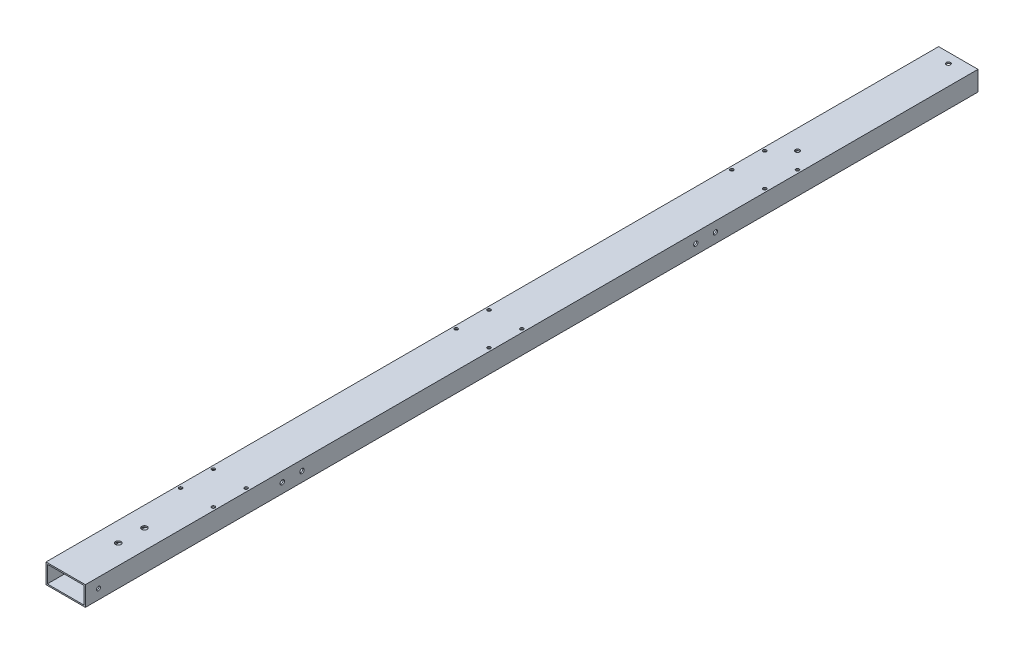
from build123d import *

# Parameters (mm, degrees)
SKETCH_1_W           = 30
SKETCH_1_H           = 15
SKETCH_1_W_2         = 28
SKETCH_1_H_2         = 13
EXTRUDE_1_DEPTH      = 800
SKETCH_4_R           = 1.5
CUT_EXTRUDE_3_DEPTH  = 801.702816281
SKETCH_5_R           = 1.65
CUT_EXTRUDE_4_DEPTH  = 801.702816281
SKETCH_6_W           = 30
SKETCH_6_H           = 15
CUT_EXTRUDE_5_DEPTH  = 300
SKETCH_8_W           = 30
SKETCH_8_H           = 15
SKETCH_8_W_2         = 28
SKETCH_8_H_2         = 13
EXTRUDE_1_2_DEPTH    = 180
SKETCH_9_R           = 2.05
CUT_EXTRUDE_7_DEPTH  = 10
CUT_EXTRUDE_8_DEPTH  = 10
SKETCH_11_R          = 1.6
CUT_EXTRUDE_9_DEPTH  = 801.702816281
CUT_EXTRUDE_10_REACH = 802.703
SKETCH_13_R          = 1.25
CUT_EXTRUDE_11_DEPTH = 801.702816281


with BuildPart() as part:
    # 草图1 → Extrude 1 (new body)
    with BuildSketch(Plane.XY):
        with Locations((15, -7.5)):
            Rectangle(SKETCH_1_W, SKETCH_1_H)
        with Locations((15, -7.5)):
            Rectangle(SKETCH_1_W_2, SKETCH_1_H_2, mode=Mode.SUBTRACT)
    extrude(amount=EXTRUDE_1_DEPTH)

    # 草图4 → 切除-拉伸3 (cut, through all)
    with BuildSketch(Plane(origin=(30, 0, 0), x_dir=(0, 0, -1), z_dir=(1, 0, 0))):
        with Locations((-790, -7.5)):
            Circle(SKETCH_4_R)
    extrude(amount=-CUT_EXTRUDE_3_DEPTH, mode=Mode.SUBTRACT)

    # 草图5 → 切除-拉伸4 (cut, through all)
    with BuildSketch(Plane(origin=(30, 0, 0), x_dir=(0, 0, -1), z_dir=(1, 0, 0))):
        with Locations((-320, -7.5)):
            Circle(SKETCH_5_R)
        with Locations((-335, -7.5)):
            Circle(SKETCH_5_R)
        with Locations((-635, -7.5)):
            Circle(SKETCH_5_R)
        with Locations((-650, -7.5)):
            Circle(SKETCH_5_R)
    extrude(amount=-CUT_EXTRUDE_4_DEPTH, mode=Mode.SUBTRACT)

    # 草图6 → 切除-拉伸5 (cut)
    with BuildSketch(Plane(origin=(0, 0, 0), x_dir=(-1, 0, 0), z_dir=(0, 0, -1))):
        with Locations((-15, -7.5)):
            Rectangle(SKETCH_6_W, SKETCH_6_H)
    extrude(amount=-CUT_EXTRUDE_5_DEPTH, mode=Mode.SUBTRACT)

    # 草图8 → Extrude 1 2 (add)
    with BuildSketch(Plane(origin=(0, 0, 300), x_dir=(-1, 0, 0), z_dir=(0, 0, -1))):
        with Locations((-15, -7.5)):
            Rectangle(SKETCH_8_W, SKETCH_8_H)
        with Locations((-15, -7.5)):
            Rectangle(SKETCH_8_W_2, SKETCH_8_H_2, mode=Mode.SUBTRACT)
    extrude(amount=EXTRUDE_1_2_DEPTH)

    # 草图9 → 切除-拉伸7 (cut)
    with BuildSketch(Plane(origin=(0, 0, 0), x_dir=(1, 0, 0), z_dir=(0, 1, 0))):
        with Locations((15, -740)):
            Circle(SKETCH_9_R)
        with Locations((15, -760)):
            Circle(SKETCH_9_R)
    extrude(amount=-CUT_EXTRUDE_7_DEPTH, mode=Mode.SUBTRACT)

    # 草图10 → 切除-拉伸8 (cut)
    with BuildSketch(Plane.XZ.offset(15)):
        with BuildLine():
            Line((8, 735), (8, 760))
            ThreePointArc((8, 760), (15, 767), (22, 760))
            Line((22, 760), (22, 735))
            ThreePointArc((22, 735), (15, 728), (8, 735))
        make_face()
    extrude(amount=-CUT_EXTRUDE_8_DEPTH, mode=Mode.SUBTRACT)

    # 草图11 → 切除-拉伸9 (cut, through all)
    with BuildSketch(Plane.XZ.offset(15)):
        with Locations((15, 127.5)):
            Circle(SKETCH_11_R)
        with Locations((15, 242.5)):
            Circle(SKETCH_11_R)
    extrude(amount=-CUT_EXTRUDE_9_DEPTH, mode=Mode.SUBTRACT)

    # 草图12 → 切除-拉伸10 (cut, up to next)
    with BuildSketch(Plane.XZ.offset(15), mode=Mode.PRIVATE) as cut_extrude_10_sk1:
        with BuildLine():
            Line((22, 247), (22, 237))
            ThreePointArc((22, 237), (15, 230), (8, 237))
            Line((8, 237), (8, 247))
            ThreePointArc((8, 247), (15, 254), (22, 247))
        make_face()
    cut_extrude_10_tool1 = extrude(cut_extrude_10_sk1.sketch, amount=-CUT_EXTRUDE_10_REACH, mode=Mode.PRIVATE) & part.part
    add(cut_extrude_10_tool1.solids().sort_by_distance((15, -15, 242))[0], mode=Mode.SUBTRACT)

    # 草图13 → 切除-拉伸11 (cut, through all)
    with BuildSketch(Plane.XZ.offset(15)):
        with Locations((27.5, 700)):
            Circle(SKETCH_13_R)
        with Locations((2.5, 700)):
            Circle(SKETCH_13_R)
        with Locations((2.5, 675)):
            Circle(SKETCH_13_R)
        with Locations((27.5, 675)):
            Circle(SKETCH_13_R)
        with Locations((27.5, 465)):
            Circle(SKETCH_13_R)
        with Locations((27.5, 490)):
            Circle(SKETCH_13_R)
        with Locations((2.5, 490)):
            Circle(SKETCH_13_R)
        with Locations((2.5, 465)):
            Circle(SKETCH_13_R)
        with Locations((27.5, 255)):
            Circle(SKETCH_13_R)
        with Locations((27.5, 280)):
            Circle(SKETCH_13_R)
        with Locations((2.5, 280)):
            Circle(SKETCH_13_R)
        with Locations((2.5, 255)):
            Circle(SKETCH_13_R)
    extrude(amount=-CUT_EXTRUDE_11_DEPTH, mode=Mode.SUBTRACT)


solid = part.part
